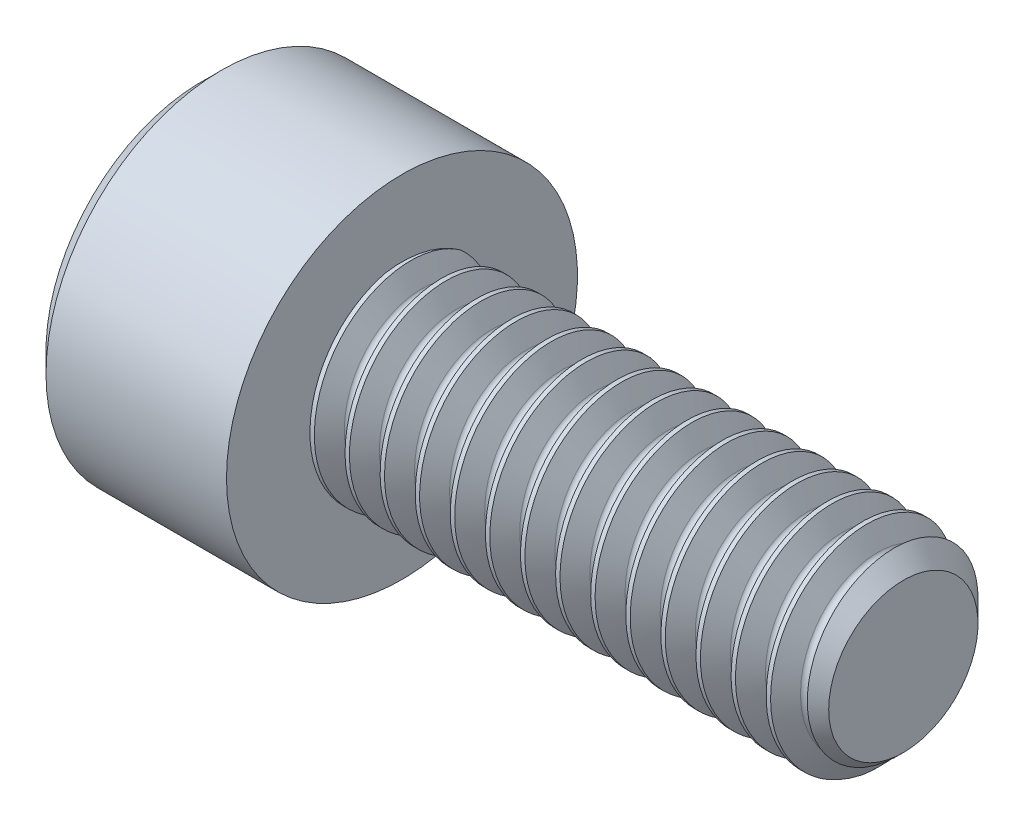
from build123d import *

# Parameters (mm, degrees)
CHAMFER1_SIZE      = 0.5
CHAMFER2_SIZE      = 0.4
CUT_EXTRUDE1_DEPTH = 2
CHAMFER3_SIZE      = 0.3
CUT_SWEEP1_PITCH   = 0.7
CUT_SWEEP1_TO      = 10


with BuildPart() as part:
    # Sketch1 → Revolve1 (revolve)
    with BuildSketch(Plane.XY, mode=Mode.PRIVATE) as revolve1_sk:
        Polygon((0, 0), (0, 3.5), (4, 3.5), (4, 1.989), (14, 1.989), (14, 0), align=None)
    revolve(revolve1_sk.sketch.rotate(Axis((-88.705490849, 0, 0), (1, 0, 0)), 90), axis=Axis((-88.705490849, 0, 0), (1, 0, 0)))

    # Chamfer1
    chamfer1_edges = [part.edges().sort_by_distance(p)[0] for p in [
        (14, 0, -1.989),
    ]]
    chamfer(chamfer1_edges, length=CHAMFER1_SIZE)

    # Chamfer2
    chamfer2_edges = [part.edges().sort_by_distance(p)[0] for p in [
        (0, 0, -3.5),
    ]]
    chamfer(chamfer2_edges, length=CHAMFER2_SIZE)

    # Sketch3 → Cut-Extrude1 (cut)
    with BuildSketch(Plane(origin=(0, 0, 0), x_dir=(0, 0, -1), z_dir=(1, 0, 0))):
        Polygon((-1.732050808, 0), (-0.866025404, -1.5), (0.866025404, -1.5), (1.732050808, 0), (0.866025404, 1.5), (-0.866025404, 1.5), align=None)
    extrude(amount=CUT_EXTRUDE1_DEPTH, mode=Mode.SUBTRACT)

    # Chamfer3
    chamfer3_edges = [part.edges().sort_by_distance(p)[0] for p in [
        (0, 0.75, 1.299038106),
        (0, -0.75, 1.299038106),
        (0, -1.5, 0),
        (0, -0.75, -1.299038106),
        (0, 0.75, -1.299038106),
        (0, 1.5, 0),
    ]]
    chamfer(chamfer3_edges, length=CHAMFER3_SIZE)

    # Cut-Sweep1: arcs per turn and ends read off the stored shape
    # Cut-Sweep1: the profile of Sketch8 screwed along a right-hand helix through 16 turns, 6 arcs to a turn; built about Z, then put on its axis
    cut_sweep1_z = Axis((0, 0, 0), (0, 0, 1))
    cut_sweep1_corners = [(1.61025, 0, -0.087468566), (2.254125, 0, -0.45920997), (2.254125, 0, 0.45920997), (1.61025, 0, 0.087468566), (1.55975, 0, 0)]
    with BuildLine(mode=Mode.PRIVATE) as cut_sweep1_profile:
        Line(cut_sweep1_corners[0], cut_sweep1_corners[1])
        Line(cut_sweep1_corners[1], cut_sweep1_corners[2])
        Line(cut_sweep1_corners[2], cut_sweep1_corners[3])
        ThreePointArc((1.61025, 0, 0.087468566), (1.573281434, 0, 0.0505), (1.55975, 0, 0))
        ThreePointArc((1.55975, 0, 0), (1.573281434, 0, -0.0505), (1.61025, 0, -0.087468566))
    cut_sweep1_cap = Face(cut_sweep1_profile.wire())
    cut_sweep1_arcs = [((1.61025, 0, 0.087468566), (1.55975, 0, 0.058312377), (1.55975, 0, 0), (1, 0.8660254037844426, 1)), ((1.55975, 0, 0), (1.55975, 0, -0.058312377), (1.61025, 0, -0.087468566), (1, 0.8660254037844426, 1))]  # start, shoulder, end, weights
    cut_sweep1_turn_angles = [0, 30, 60, 90, 120, 150, 180, 210, 240, 270, 300, 330, 360]
    cut_sweep1_turn_weights = [1, 0.8660254037844387, 1, 0.8660254037844387, 1, 0.8660254037844387, 1, 0.8660254037844387, 1, 0.8660254037844387, 1, 0.8660254037844387, 1]
    cut_sweep1_turn_rails = [Edge.make_bspline([Vector(p[0], p[1], 0).rotate(cut_sweep1_z, cut_sweep1_turn_angles[k]) / cut_sweep1_turn_weights[k] + Vector(0, 0, p[2] + CUT_SWEEP1_PITCH * cut_sweep1_turn_angles[k] / 360) for k in range(13)], [0, 0, 0, 1, 1, 2, 2, 3, 3, 4, 4, 5, 5, 6, 6, 6], 2, cut_sweep1_turn_weights) for p in cut_sweep1_corners]
    cut_sweep1_turn_sides = [*[Face.make_surface_from_curves(cut_sweep1_turn_rails[p[0]], cut_sweep1_turn_rails[p[1]]) for p in [(0, 1), (1, 2), (2, 3)]], *[Face.make_bezier_surface([[Vector(p[j][0], p[j][1], 0).rotate(cut_sweep1_z, cut_sweep1_turn_angles[2 * i + k]) / cut_sweep1_turn_weights[2 * i + k] + Vector(0, 0, p[j][2] + CUT_SWEEP1_PITCH * cut_sweep1_turn_angles[2 * i + k] / 360) for k in range(3)] for j in range(3)], [[p[3][j] * cut_sweep1_turn_weights[2 * i + k] for k in range(3)] for j in range(3)]) for p in cut_sweep1_arcs for i in range(6)]]
    cut_sweep1_turn = Solid(Shell([*cut_sweep1_turn_sides, cut_sweep1_cap, cut_sweep1_cap.rotate(cut_sweep1_z, 360).moved(Location((0, 0, CUT_SWEEP1_PITCH * 360 / 360)))]))
    cut_sweep1_each = [*[cut_sweep1_turn.moved(Location((0, 0, CUT_SWEEP1_PITCH * i))) for i in range(16)]]
    add(Plane(origin=(14, 0, 0), x_dir=(0, 0, -1), z_dir=(-1, 0, 0)) * split(Compound([cut_sweep1_each[i] for i in range(0, 16, 2)]), bisect_by=Plane.XY.offset(CUT_SWEEP1_TO), keep=Keep.BOTTOM, mode=Mode.PRIVATE), mode=Mode.SUBTRACT)
    add(Plane(origin=(14, 0, 0), x_dir=(0, 0, -1), z_dir=(-1, 0, 0)) * split(Compound([cut_sweep1_each[i] for i in range(1, 16, 2)]), bisect_by=Plane.XY.offset(CUT_SWEEP1_TO), keep=Keep.BOTTOM, mode=Mode.PRIVATE), mode=Mode.SUBTRACT)


solid = part.part
